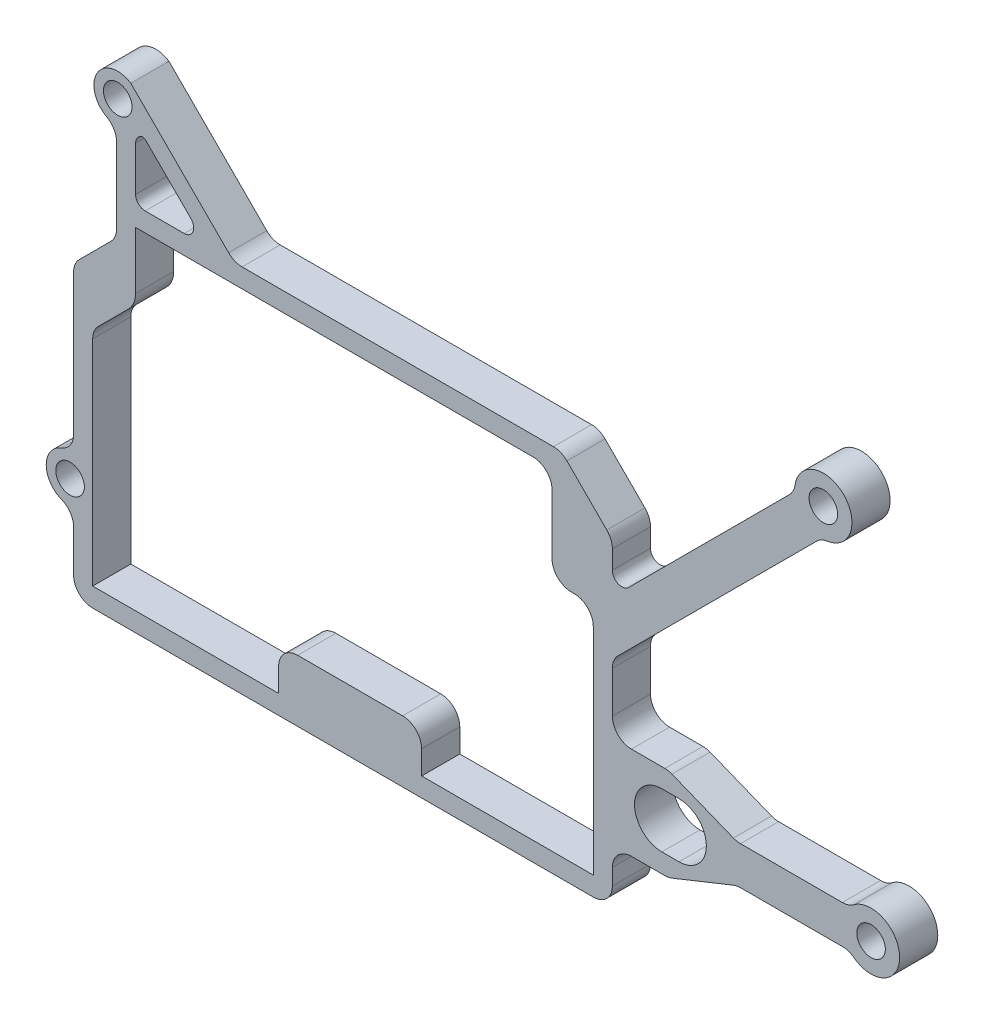
from build123d import *

# Parameters (mm, degrees)
BOSS_EXTRUDE1_DEPTH = 4
SKETCH5_R           = 1.5
CUT_EXTRUDE1_DEPTH  = 3
SKETCH6_R           = 1.5
CUT_EXTRUDE2_DEPTH  = 3
FILLET1_R           = 2
FILLET2_R           = 1


with BuildPart() as part:
    # Sketch4 → Boss-Extrude1 (new body)
    with BuildSketch(Plane(origin=(0, 0, 0), x_dir=(0, 1, 0), z_dir=(0, 0, 1))):
        with BuildLine():
            Line((-2, -27.920633468), (-2, -39.763932023))
            ThreePointArc((-2, -39.763932023), (0, -45), (2, -39.763932023))
            Line((2, -39.763932023), (2, -27.920633468))
            Line((2, -27.920633468), (4.867831403, -20.764056013))
            Line((4.867831403, -20.764056013), (4.867831403, -14.872797682))
            Line((4.867831403, -14.872797682), (12.044370558, -14.872797682))
            Line((12.044370558, -14.872797682), (34.004647608, -36.833074732))
            ThreePointArc((34.004647608, -36.833074732), (39.121320344, -39.121320344), (36.833074732, -34.004647608))
            Line((36.833074732, -34.004647608), (17.701224807, -14.872797682))
            Line((17.701224807, -14.872797682), (22.894335258, -14.872797682))
            Line((22.894335258, -14.872797682), (28.248854336, -9.518278604))
            Line((28.248854336, -9.518278604), (28.248854336, 24.78907846))
            Line((28.248854336, 24.78907846), (38.365899309, 34.906123433))
            Line((38.365899309, 34.906123433), (39.093876567, 35.634100691))
            ThreePointArc((39.093876567, 35.634100691), (37.77325109, 39.377410935), (34.503238183, 37.127202318))
            Line((34.503238183, 37.127202318), (24.284388241, 37.127202318))
            Line((24.284388241, 37.127202318), (19.784388241, 41.627202318))
            Line((19.784388241, 41.627202318), (2.472048116, 41.627202318))
            ThreePointArc((2.472048116, 41.627202318), (0, 44.5), (-2.472048116, 41.627202318))
            Line((-2.472048116, 41.627202318), (-10.570956119, 41.627202318))
            Line((-10.570956119, 41.627202318), (-10.570956119, -14.872797682))
            Line((-10.570956119, -14.872797682), (-4.867831403, -14.872797682))
            Line((-4.867831403, -14.872797682), (-4.867831403, -20.764056013))
            Line((-4.867831403, -20.764056013), (-2, -27.920633468))
        make_face()
        with BuildLine():
            ThreePointArc((-2.867831403, -20.065196532), (0, -17.197365128), (2.867831403, -20.065196532))
            Line((2.867831403, -20.065196532), (2.867831403, -21.860808403))
            ThreePointArc((2.867831403, -21.860808403), (0, -24.728639806), (-2.867831403, -21.860808403))
            Line((-2.867831403, -21.860808403), (-2.867831403, -20.065196532))
        make_face(mode=Mode.SUBTRACT)
        with BuildLine():
            Line((15.992780239, -12.872797682), (-8.570956119, -12.872797682))
            Line((-8.570956119, -12.872797682), (-8.570956119, 5.127202318))
            Line((-8.570956119, 5.127202318), (-4.107420483, 5.127202318))
            Line((-4.107420483, 5.127202318), (-4.107420483, 20.127202318))
            Line((-4.107420483, 20.127202318), (-8.570956119, 20.127202318))
            Line((-8.570956119, 20.127202318), (-8.570956119, 39.627202318))
            Line((-8.570956119, 39.627202318), (14.71332043, 39.627202318))
            Line((14.71332043, 39.627202318), (18.481087383, 35.859435365))
            ThreePointArc((18.481087383, 35.859435365), (19.292145755, 35.317503486), (20.248854336, 35.127202318))
            Line((20.248854336, 35.127202318), (26.248854336, 35.127202318))
            Line((26.248854336, 35.127202318), (26.248854336, -4.702478507))
            Line((26.248854336, -4.702478507), (26.248854336, -8.550773098))
            Line((26.248854336, -8.550773098), (15.992780239, -8.550773098))
            Line((15.992780239, -8.550773098), (15.992780239, -12.872797682))
        make_face(mode=Mode.SUBTRACT)
        Polygon((34.905300686, 34.273951935), (28.248854336, 27.617505584), (28.248854336, 35.127202318), (34.905300686, 35.127202318), align=None, mode=Mode.SUBTRACT)
    extrude(amount=BOSS_EXTRUDE1_DEPTH)

    # Sketch5 → Cut-Extrude1 (cut)
    with BuildSketch(Plane.XY.offset(4)):
        with Locations((-37, 37)):
            Circle(SKETCH5_R)
        with Locations((-42, 0)):
            Circle(SKETCH5_R)
        with Locations((37, 37)):
            Circle(SKETCH5_R)
        with Locations((42, 0)):
            Circle(SKETCH5_R)
    extrude(amount=-CUT_EXTRUDE1_DEPTH, mode=Mode.SUBTRACT)

    # Sketch6 → Cut-Extrude2 (cut)
    with BuildSketch(Plane(origin=(0, 0, 0), x_dir=(1, 0, 0), z_dir=(0, 0, -1))):
        with Locations(Location((-17.127202318, 7.251145664, 0), (0, 0, 180))):
            Circle(SKETCH6_R)
        with Locations(Location((-9.127202318, 7.251145664, 0), (0, 0, 180))):
            Circle(SKETCH6_R)
        with Locations(Location((11.372797682, -20.248854336, 0), (0, 0, 180))):
            Circle(SKETCH6_R)
        with Locations(Location((-37.627202318, -20.248854336, 0), (0, 0, 180))):
            Circle(SKETCH6_R)
    extrude(amount=-CUT_EXTRUDE2_DEPTH, mode=Mode.SUBTRACT)

    # Fillet1
    fillet1_edges = [part.edges().sort_by_distance(p)[0] for p in [
        (-41.627202318, 19.784388241, 2),
        (-37.127202318, 24.284388241, 2),
        (-37.127202318, 34.503238183, 2),
        (-24.78907846, 28.248854336, 2),
        (9.518278604, 28.248854336, 2),
        (14.872797682, 22.894335258, 2),
        (34.004647608, 36.833074732, 2),
        (36.833074732, 34.004647608, 2),
        (14.872797682, 12.044370558, 2),
        (14.872797682, 4.867831403, 2),
        (20.764056013, 4.867831403, 2),
        (27.920633468, 2, 2),
        (39.763932023, 2, 2),
        (39.763932023, -2, 2),
        (27.920633468, -2, 2),
        (20.764056013, -4.867831403, 2),
        (14.872797682, -4.867831403, 2),
        (14.872797682, -10.570956119, 2),
        (-41.627202318, -10.570956119, 2),
        (-41.627202318, -2.472048116, 2),
        (-41.627202318, 2.472048116, 2),
        (-39.627202318, 14.71332043, 2),
        (-20.127202318, -4.107420483, 2),
        (-5.127202318, -4.107420483, 2),
        (12.872797682, 15.992780239, 2),
        (8.550773098, 15.992780239, 2),
        (8.550773098, 26.248854336, 2),
    ]]
    fillet(fillet1_edges, radius=FILLET1_R)

    # Fillet2
    # the kernel refuses this fillet: 1 mm, written as the material it adds along each edge
    with BuildSketch(Plane(origin=(14.872797682, 17.701224807, 0), x_dir=(0, 1, 0), z_dir=(0, 0, 1))) as fillet2_piece_1:
        with BuildLine():
            CenterArc((FILLET2_R * 2.41421356237, -FILLET2_R), FILLET2_R, 90, 135)
            Line((FILLET2_R * 1.70710678119, -FILLET2_R * 1.70710678119), (0, 0))
            Line((0, 0), (FILLET2_R * 2.41421356237, 0))
        make_face()
    extrude(amount=4)
    with BuildSketch(Plane(origin=(-34.273951935, 34.905300686, 0), x_dir=(0.7071067811865476, -0.7071067811865476, 0), z_dir=(0, 0, 1))) as fillet2_piece_2:
        with BuildLine():
            CenterArc((FILLET2_R * 0.414213562373, -FILLET2_R), FILLET2_R, 90, 45)
            Line((-FILLET2_R * 0.292893218813, -FILLET2_R * 0.292893218814), (0, 0))
            Line((0, 0), (FILLET2_R * 0.414213562373, 0))
        make_face()
    extrude(amount=4)
    with BuildSketch(Plane(origin=(-35.127202318, 34.905300686, 0), x_dir=(1, 0, 0), z_dir=(0, 0, 1))) as fillet2_piece_3:
        with BuildLine():
            CenterArc((FILLET2_R, -FILLET2_R), FILLET2_R, 90, 90)
            Line((0, -FILLET2_R), (0, 0))
            Line((0, 0), (FILLET2_R, 0))
        make_face()
    extrude(amount=4)
    with BuildSketch(Plane(origin=(-35.127202318, 28.248854336, 0), x_dir=(1, 0, 0), z_dir=(0, 0, 1))) as fillet2_piece_4:
        with BuildLine():
            CenterArc((FILLET2_R, FILLET2_R), FILLET2_R, 180, 90)
            Line((0, FILLET2_R), (0, 0))
            Line((0, 0), (FILLET2_R, 0))
        make_face()
    extrude(amount=4)
    with BuildSketch(Plane(origin=(-27.617505584, 28.248854336, 0), x_dir=(-0.7071067811865468, 0.7071067811865482, 0), z_dir=(0, 0, 1))) as fillet2_piece_5:
        with BuildLine():
            CenterArc((FILLET2_R * 2.41421356237, FILLET2_R), FILLET2_R, 135, 135)
            Line((FILLET2_R * 1.70710678119, FILLET2_R * 1.70710678119), (0, 0))
            Line((0, 0), (FILLET2_R * 2.41421356237, 0))
        make_face()
    extrude(amount=4)


solid = part.part
